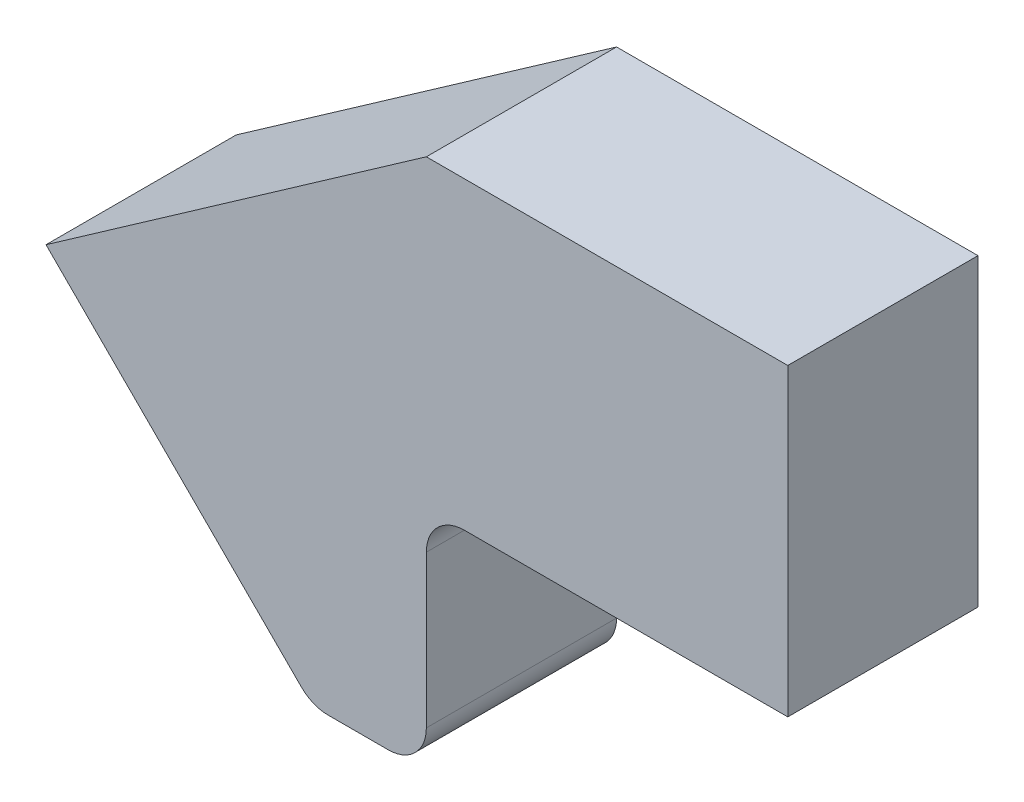
from build123d import *

# Parameters (mm, degrees)
BOSS_EXTRUDE1_DEPTH = 0.125
FILLET1_R           = 0.05


with BuildPart() as part:
    # frame_outline → Boss-Extrude1 (new, symmetric)
    with BuildSketch(Plane.XY):
        Polygon((0, 0), (0.499851802, 0.35), (0.974851802, 0.35), (0.974851802, -0.05), (0.499851802, -0.05), (0.499851802, -0.35), (0.35, -0.35), align=None)
    extrude(amount=BOSS_EXTRUDE1_DEPTH, both=True)

    # Fillet1
    fillet1_edges = [part.edges().sort_by_distance(p)[0] for p in [
        (0.499851802, -0.35, 0),
        (0.499851802, -0.05, 0),
        (0.35, -0.35, 0),
    ]]
    fillet(fillet1_edges, radius=FILLET1_R)


solid = part.part
